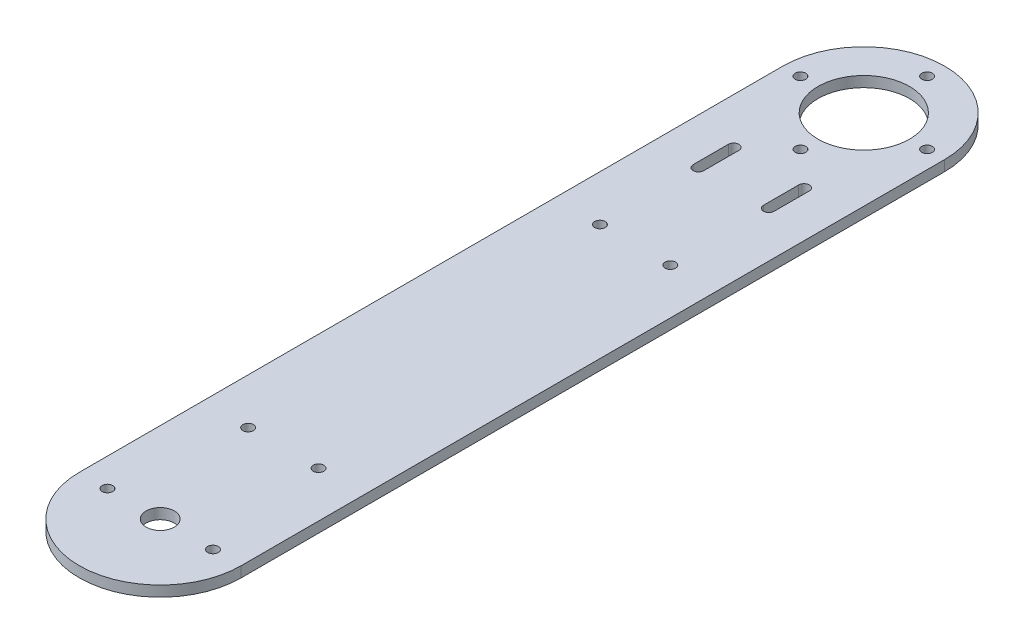
from build123d import *

# Parameters (mm, degrees)
SKETCH_1_R             = 4
SKETCH_1_R_2           = 1.5
SKETCH_1_R_3           = 13
SM_BASE_FLANGE_1_DEPTH = 3


# Sheet-metal steps are written as plain solids
with BuildPart() as part:
    # Sketch 1 → 基体-法兰1 (new body)
    with BuildSketch(Plane(origin=(0, 0, 0), x_dir=(1, 0, 0), z_dir=(0, 1, 0))):
        with BuildLine():
            Line((23, 200), (23, 0))
            ThreePointArc((23, 0), (0, -23), (-23, 0))
            Line((-23, 0), (-23, 200))
            ThreePointArc((-23, 200), (0, 223), (23, 200))
        make_face()
        with Locations(Location((0, 0, 0), (0, 0, 270))):
            Circle(SKETCH_1_R, mode=Mode.SUBTRACT)
        with Locations(Location((-10, 35, 0), (0, 0, 270))):
            Circle(SKETCH_1_R_2, mode=Mode.SUBTRACT)
        with Locations(Location((10, 35, 0), (0, 0, 270))):
            Circle(SKETCH_1_R_2, mode=Mode.SUBTRACT)
        with Locations(Location((-10, 135, 0), (0, 0, 270))):
            Circle(SKETCH_1_R_2, mode=Mode.SUBTRACT)
        with Locations(Location((10, 135, 0), (0, 0, 270))):
            Circle(SKETCH_1_R_2, mode=Mode.SUBTRACT)
        with Locations(Location((0, 200, 0), (0, 0, 270))):
            Circle(SKETCH_1_R_3, mode=Mode.SUBTRACT)
        with Locations(Location((15, 0, 0), (0, 0, 270))):
            Circle(SKETCH_1_R_2, mode=Mode.SUBTRACT)
        with Locations(Location((-15, 0, 0), (0, 0, 270))):
            Circle(SKETCH_1_R_2, mode=Mode.SUBTRACT)
        with Locations(Location((0, 218, 0), (0, 0, 270))):
            Circle(SKETCH_1_R_2, mode=Mode.SUBTRACT)
        with Locations(Location((18, 200, 0), (0, 0, 270))):
            Circle(SKETCH_1_R_2, mode=Mode.SUBTRACT)
        with Locations(Location((0, 182, 0), (0, 0, 270))):
            Circle(SKETCH_1_R_2, mode=Mode.SUBTRACT)
        with Locations(Location((-18, 200, 0), (0, 0, 270))):
            Circle(SKETCH_1_R_2, mode=Mode.SUBTRACT)
        with BuildLine():
            Line((-8.5, 173), (-8.5, 163))
            ThreePointArc((-8.5, 163), (-10, 161.5), (-11.5, 163))
            Line((-11.5, 163), (-11.5, 173))
            ThreePointArc((-11.5, 173), (-10, 174.5), (-8.5, 173))
        make_face(mode=Mode.SUBTRACT)
        with BuildLine():
            Line((8.5, 163), (8.5, 173))
            ThreePointArc((8.5, 173), (10, 174.5), (11.5, 173))
            Line((11.5, 173), (11.5, 163))
            ThreePointArc((11.5, 163), (10, 161.5), (8.5, 163))
        make_face(mode=Mode.SUBTRACT)
    extrude(amount=-SM_BASE_FLANGE_1_DEPTH)


solid = part.part
